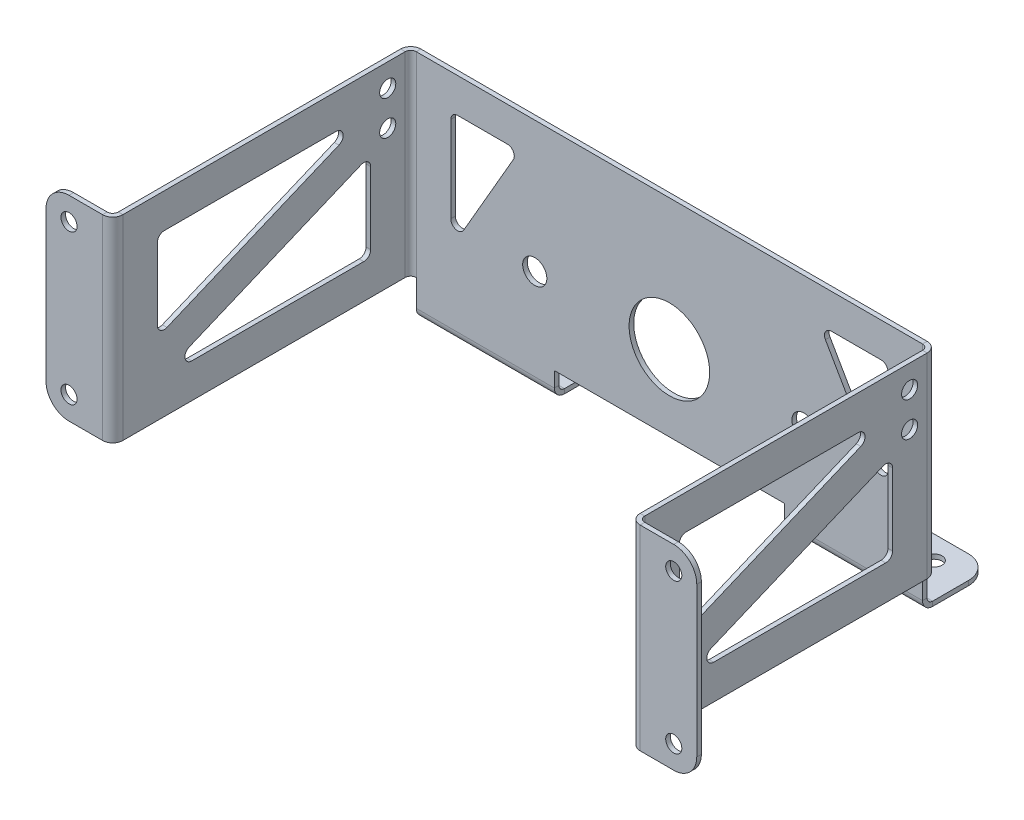
from build123d import *

# Parameters (mm, degrees)
SM_START                           = -110
SM_BASE_FLANGE_1_DEPTH             = 220
SKETCH_6_R                         = 17.5
CUT_EXTRUDE_1_DEPTH                = 10
HOLE_WIZARD_7_0_7_1_D              = 7
SKETCH_21_W                        = 100
SKETCH_21_H                        = 11
CUT_EXTRUDE_4_DEPTH                = 153.318744743
FILLET_1_R                         = 10
SM_EDGE_FLANGE_1_DEPTH             = 85
SM_EDGE_FLANGE_1_BEND_DEPTH        = 85
SM_EDGE_FLANGE_2_STRIP_W           = 12.8
SM_EDGE_FLANGE_2_STRIP_H           = 2
SM_EDGE_FLANGE_2_STRIP_CUT_DEPTH   = 85
SM_EDGE_FLANGE_2_STRIP_2_W         = 12.8
SM_EDGE_FLANGE_2_STRIP_2_H         = 2
SM_EDGE_FLANGE_2_STRIP_CUT_2_DEPTH = 85
SM_EDGE_FLANGE_2_DEPTH             = 85
SM_EDGE_FLANGE_2_BEND_DEPTH        = 85
FILLET_2_R                         = 10
CUT_EXTRUDE_5_DEPTH                = 304.981726424
CUT_EXTRUDE_6_DEPTH                = 10
HOLE_WIZARD_7_0_7_2_D              = 7
HOLE_WIZARD_7_0_7_2_DEPTH          = 14
HOLE_WIZARD_7_0_7_2_TIP            = 2.103012167
F_7_0_7_DIAMETER_HOLE1_AT_2_COUNT  = 2
F_7_0_7_DIAMETER_HOLE1_AT_2_PITCH  = 15
F_10_5_10_5_DIAMETER_HOLE1_D       = 10.5


# Read off the part's stored shape, not the designer's step: Базовая кромка1
# Sheet-metal steps are written as plain solids
with BuildPart() as part:
    # Базовая кромка1 outline → Базовая кромка1 (new body)
    with BuildSketch(Plane(origin=(0, 0, 0), x_dir=(0, 0, -1), z_dir=(1, 0, 0)).offset(SM_START)):
        with BuildLine():
            Line((4.4, 0), (30, 0))
            Line((30, 0), (30, 2))
            Line((30, 2), (4.4, 2))
            ThreePointArc((4.4, 2), (2.702943725, 2.702943725), (2, 4.4))
            Line((2, 4.4), (2, 101))
            Line((2, 101), (0, 101))
            Line((0, 101), (0, 4.4))
            ThreePointArc((0, 4.4), (1.288730163, 1.288730163), (4.4, 0))
        make_face()
    extrude(amount=SM_BASE_FLANGE_1_DEPTH)

    # Эскиз6 → Вырез-Вытянуть1 (cut)
    with BuildSketch(Plane.XY):
        with Locations((0, 44)):
            Circle(SKETCH_6_R)
    extrude(amount=-CUT_EXTRUDE_1_DEPTH, mode=Mode.SUBTRACT)

    # Диаметр отверстия Ø7.0 (7)1 (through all)
    with Locations(Plane(origin=(0, 0, 0), x_dir=(-1, 0, 0), z_dir=(0, -1, 0))):
        with Locations((95, 20), (65, 20), (-65, 20), (-95, 20)):
            Hole(HOLE_WIZARD_7_0_7_1_D / 2)

    # Эскиз21 → Вырез-Вытянуть4 (cut, through all)
    with BuildSketch(Plane.XY):
        with Locations((0, 5.5)):
            Rectangle(SKETCH_21_W, SKETCH_21_H)
    extrude(amount=-CUT_EXTRUDE_4_DEPTH, mode=Mode.SUBTRACT)

    # Скругление1
    fillet_1_edges = [part.edges().sort_by_distance(p)[0] for p in [
        (110, 1, -30),
        (-50, 1, -30),
        (50, 1, -30),
        (-110, 1, -30),
    ]]
    fillet(fillet_1_edges, radius=FILLET_1_R)

    # Ребро-кромка1 section (across the edge) → Ребро-кромка1 (add)
    with BuildSketch(Plane(origin=(112.4, 16, 0), x_dir=(-1, 0, 0), z_dir=(0, 1, 0))):
        with BuildLine():
            Line((-2, 2.4), (-2, 129.5))
            Line((-2, 129.5), (0, 129.5))
            Line((0, 129.5), (0, 2.4))
            ThreePointArc((0, 2.4), (0.702943725, 0.702943725), (2.4, 0))
            Line((2.4, 0), (2.4, -2))
            ThreePointArc((2.4, -2), (-0.711269837, -0.711269837), (-2, 2.4))
        make_face()
    extrude(amount=SM_EDGE_FLANGE_1_DEPTH)

    # Ребро-кромка1 section 2 (across the edge) → Ребро-кромка1 bend (add)
    with BuildSketch(Plane(origin=(-112.4, 101, 0), x_dir=(1, 0, 0), z_dir=(0, -1, 0))):
        with BuildLine():
            Line((-2, 2.4), (-2, 129.5))
            Line((-2, 129.5), (0, 129.5))
            Line((0, 129.5), (0, 2.4))
            ThreePointArc((0, 2.4), (0.702943725, 0.702943725), (2.4, 0))
            Line((2.4, 0), (2.4, -2))
            ThreePointArc((2.4, -2), (-0.711269837, -0.711269837), (-2, 2.4))
        make_face()
    extrude(amount=SM_EDGE_FLANGE_1_BEND_DEPTH)

    # Ребро-кромка2 strip (across the edge) → Ребро-кромка2 strip cut (cut)
    with BuildSketch(Plane(origin=(114.4, 101, 129.5), x_dir=(0, 0, -1), z_dir=(0, -1, 0))):
        with Locations((-2, -1)):
            Rectangle(SM_EDGE_FLANGE_2_STRIP_W, SM_EDGE_FLANGE_2_STRIP_H)
    extrude(amount=SM_EDGE_FLANGE_2_STRIP_CUT_DEPTH, mode=Mode.SUBTRACT)

    # Ребро-кромка2 strip 2 (across the edge) → Ребро-кромка2 strip cut 2 (cut)
    with BuildSketch(Plane(origin=(-114.4, 16, 129.5), x_dir=(0, 0, -1), z_dir=(0, 1, 0))):
        with Locations((-2, -1)):
            Rectangle(SM_EDGE_FLANGE_2_STRIP_2_W, SM_EDGE_FLANGE_2_STRIP_2_H)
    extrude(amount=SM_EDGE_FLANGE_2_STRIP_CUT_2_DEPTH, mode=Mode.SUBTRACT)

    # Ребро-кромка2 section (across the edge) → Ребро-кромка2 (add)
    with BuildSketch(Plane(origin=(114.4, 101, 129.5), x_dir=(0, 0, -1), z_dir=(0, -1, 0))):
        with BuildLine():
            Line((0, 2.4), (0, 27))
            Line((0, 27), (2, 27))
            Line((2, 27), (2, 2.4))
            ThreePointArc((2, 2.4), (2.702943725, 0.702943725), (4.4, 0))
            Line((4.4, 0), (4.4, -2))
            ThreePointArc((4.4, -2), (1.288730163, -0.711269837), (0, 2.4))
        make_face()
    extrude(amount=SM_EDGE_FLANGE_2_DEPTH)

    # Ребро-кромка2 section 2 (across the edge) → Ребро-кромка2 bend (add)
    with BuildSketch(Plane(origin=(-114.4, 16, 129.5), x_dir=(0, 0, -1), z_dir=(0, 1, 0))):
        with BuildLine():
            Line((0, 2.4), (0, 27))
            Line((0, 27), (2, 27))
            Line((2, 27), (2, 2.4))
            ThreePointArc((2, 2.4), (2.702943725, 0.702943725), (4.4, 0))
            Line((4.4, 0), (4.4, -2))
            ThreePointArc((4.4, -2), (1.288730163, -0.711269837), (0, 2.4))
        make_face()
    extrude(amount=SM_EDGE_FLANGE_2_BEND_DEPTH)

    # Скругление2
    fillet_2_edges = [part.edges().sort_by_distance(p)[0] for p in [
        (141.4, 101, 128.5),
        (141.4, 16, 128.5),
        (-141.4, 16, 128.5),
        (-141.4, 101, 128.5),
    ]]
    fillet(fillet_2_edges, radius=FILLET_2_R)

    # Эскиз34 → Вырез-Вытянуть5 (cut, through all)
    with BuildSketch(Plane(origin=(114.4, 0, 0), x_dir=(0, 0, -1), z_dir=(1, 0, 0))):
        with BuildLine():
            Line((-107.1, 86), (-32.357951658, 86))
            ThreePointArc((-32.357951658, 86), (-29.416528086, 83.589938443), (-31.201112429, 80.232018245))
            Line((-31.201112429, 80.232018245), (-105.943160771, 48.99462536))
            ThreePointArc((-105.943160771, 48.99462536), (-108.762751081, 49.265557087), (-110.1, 51.762607115))
            Line((-110.1, 51.762607115), (-110.1, 83))
            ThreePointArc((-110.1, 83), (-109.221320344, 85.121320344), (-107.1, 86))
        make_face()
        with BuildLine():
            Line((-96.298887571, 36.767981755), (-21.556839229, 68.00537464))
            ThreePointArc((-21.556839229, 68.00537464), (-18.737248919, 67.734442913), (-17.4, 65.237392885))
            Line((-17.4, 65.237392885), (-17.4, 34))
            ThreePointArc((-17.4, 34), (-18.278679656, 31.878679656), (-20.4, 31))
            Line((-20.4, 31), (-95.142048342, 31))
            ThreePointArc((-95.142048342, 31), (-98.083471914, 33.410061557), (-96.298887571, 36.767981755))
        make_face()
    extrude(amount=-CUT_EXTRUDE_5_DEPTH, mode=Mode.SUBTRACT)

    # Эскиз35 → Вырез-Вытянуть6 (cut)
    with BuildSketch(Plane.XY):
        with BuildLine():
            Line((-70.404878533, 86), (-92, 86))
            ThreePointArc((-92, 86), (-94.121320344, 85.121320344), (-95, 83))
            Line((-95, 83), (-95, 45.596152423))
            ThreePointArc((-95, 45.596152423), (-92.776457135, 42.698374944), (-89.401923789, 44.096152423))
            Line((-89.401923789, 44.096152423), (-67.806802321, 81.5))
            ThreePointArc((-67.806802321, 81.5), (-67.806802321, 84.5), (-70.404878533, 86))
        make_face()
        with BuildLine():
            Line((95, 83), (95, 45.596152423))
            ThreePointArc((95, 45.596152423), (92.776457135, 42.698374944), (89.401923789, 44.096152423))
            Line((89.401923789, 44.096152423), (67.806802321, 81.5))
            ThreePointArc((67.806802321, 81.5), (67.806802321, 84.5), (70.404878533, 86))
            Line((70.404878533, 86), (92, 86))
            ThreePointArc((92, 86), (94.121320344, 85.121320344), (95, 83))
        make_face()
    extrude(amount=-CUT_EXTRUDE_6_DEPTH, mode=Mode.SUBTRACT)

    # Диаметр отверстия Ø7.0 (7)2
    with Locations(Plane.XY.offset(129.5)):
        with Locations((-131.4, 91), (-131.4, 26), (131.4, 91), (131.4, 26)):
            Hole(HOLE_WIZARD_7_0_7_2_D / 2, depth=HOLE_WIZARD_7_0_7_2_DEPTH)
            with Locations((0, 0, -(HOLE_WIZARD_7_0_7_2_DEPTH + HOLE_WIZARD_7_0_7_2_TIP / 2))):  # 118° drill point
                Cone(0, HOLE_WIZARD_7_0_7_2_D / 2, HOLE_WIZARD_7_0_7_2_TIP, mode=Mode.SUBTRACT)

    # Эскиз40 → Ø7.0 (7) Diameter Hole1 (revolve, cut)
    with BuildSketch(Plane(origin=(114.4, 91, 10), x_dir=(0, 0, -1), z_dir=(0, 1, 0))):
        Polygon((0, 0), (0, 7.103012167), (3.5, 5), (3.5, 0), align=None)
    f_7_0_7_diameter_hole1 = revolve(axis=Axis((120.75, 91, 10), (-1, 0, 0)), mode=Mode.SUBTRACT)

    # Ø7.0 (7) Diameter Hole1 at 2: Ø7.0 (7) Diameter Hole1 ×2
    with Locations(*[(0, -i * F_7_0_7_DIAMETER_HOLE1_AT_2_PITCH, 0) for i in range(1, F_7_0_7_DIAMETER_HOLE1_AT_2_COUNT)]):
        add(f_7_0_7_diameter_hole1, mode=Mode.SUBTRACT)

    # Зеркальное отражение1: Ø7.0 (7) Diameter Hole1 across plane
    add(f_7_0_7_diameter_hole1.mirror(Plane(origin=(0, 0, 0), x_dir=(0, 0, 1), z_dir=(1, 0, 0))), mode=Mode.SUBTRACT)

    # Зеркальное отражение1 copy 1 sketch → Зеркальное отражение1 copy 1 (revolve, cut)
    with BuildSketch(Plane(origin=(-114.4, 76, 10), x_dir=(0, 0, -1), z_dir=(0, 1, 0))):
        Polygon((0, 0), (0, -7.103012167), (3.5, -5), (3.5, 0), align=None)
    revolve(axis=Axis((-120.75, 76, 10), (-1, 0, 0)), mode=Mode.SUBTRACT)

    # Ø10.5 (10.5) Diameter Hole1 (through all)
    with Locations(Plane(origin=(0, 0, -2), x_dir=(-1, 0, 0), z_dir=(0, 0, -1))):
        with Locations((-58.5, 44), (58.5, 44)):
            Hole(F_10_5_10_5_DIAMETER_HOLE1_D / 2)


solid = part.part
